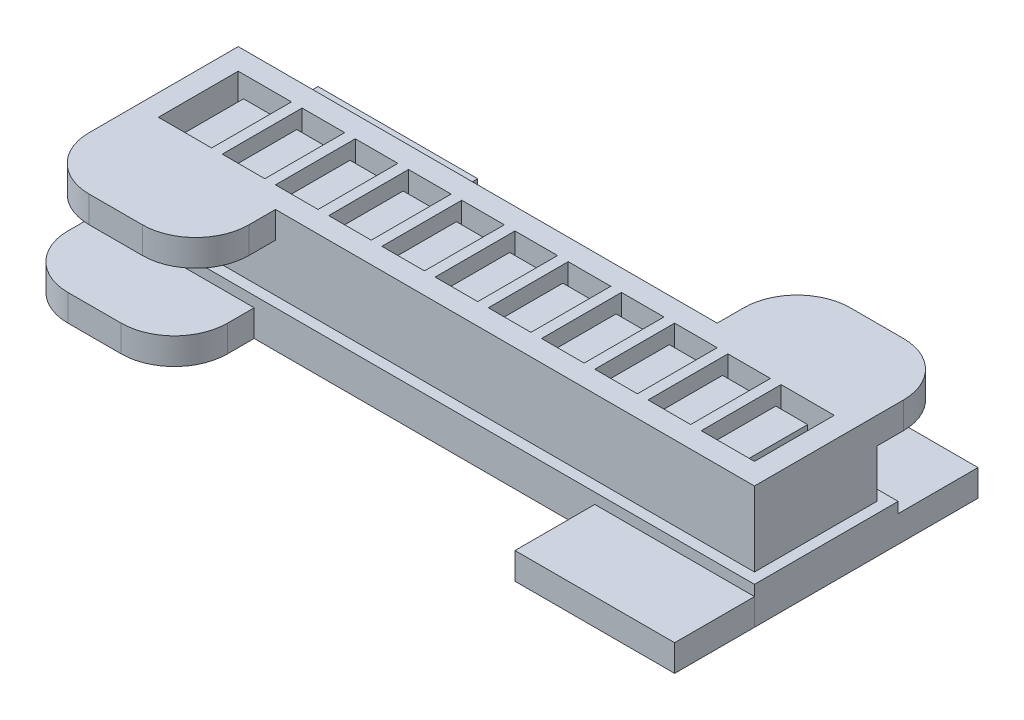
from build123d import *

# Parameters (mm, degrees)
SKETCH1_W                      = 8
SKETCH1_H                      = 15
FIRST_CHAMBER_BLOCK_DEPTH      = 15
SKETCH2_W                      = 6
SKETCH2_H                      = 11
FIRST_CHAMBER_CAVITY_DEPTH     = 13
SKETCH3_W                      = 15
SKETCH3_H                      = 3
CHAMBER_SPACER_DEPTH           = 2
PATTERN_CHAMBERS_COUNT         = 11
PATTERN_CHAMBERS_PITCH         = 10
SKETCH4_W                      = 15
SKETCH4_H                      = 12
THICKEN_END_1_DEPTH            = 2
SKETCH5_W                      = 15
SKETCH5_H                      = 15
THICKEN_END_2_DEPTH            = 2
SKETCH6_W                      = 94
SKETCH6_H                      = 2
CENTRAL_AIR_CHANNEL_DEPTH      = 2
SKETCH7_W                      = 108
SKETCH7_H                      = 13
SKETCH7_W_2                    = 106
SKETCH7_H_2                    = 11
BONDING_RIDGE_DEPTH            = 2
SKETCH9_W                      = 2
SKETCH9_H                      = 2.5
BONDING_BUMPS_DEPTH            = 2
PATTERN_BONDING_BUMPS_COUNT    = 10
PATTERN_BONDING_BUMPS_PITCH    = 10
SKETCH10_W                     = 120
SKETCH10_H                     = 23
ENCASING_BLOCK_DEPTH           = 21
SPLIT_START                    = -6
SPLIT_MOLD_OUTLINE_W           = 120
SPLIT_MOLD_OUTLINE_H           = 23
SPLIT_MOLD_OUTLINE_W_2         = 108
SPLIT_MOLD_OUTLINE_H_2         = 13
SPLIT_MOLD_OUTLINE_W_3         = 106
SPLIT_MOLD_OUTLINE_H_3         = 11
SPLIT_MOLD_OUTLINE_W_4         = 2
SPLIT_MOLD_OUTLINE_H_4         = 2.5
SPLIT_MOLD_DEPTH               = 6
SPLIT_MOLD_2_OUTLINE_W         = 108
SPLIT_MOLD_2_OUTLINE_H         = 13
SPLIT_MOLD_2_OUTLINE_W_2       = 106
SPLIT_MOLD_2_OUTLINE_H_2       = 11
SPLIT_MOLD_2_OUTLINE_W_3       = 2
SPLIT_MOLD_2_OUTLINE_H_3       = 2.5
SPLIT_MOLD_2_DEPTH             = 4
SPLIT_MOLD_3_OUTLINE_W         = 6
SPLIT_MOLD_3_OUTLINE_H         = 11
SPLIT_MOLD_3_DEPTH             = 13
SPLIT_MOLD_4_OUTLINE_W         = 4
SPLIT_MOLD_4_OUTLINE_H         = 2
SPLIT_MOLD_4_DEPTH             = 2
SPLIT_MOLD_5_OUTLINE_W         = 120
SPLIT_MOLD_5_OUTLINE_H         = 23
SPLIT_MOLD_5_DEPTH             = 6
SPLIT_MOLD_6_OUTLINE_W         = 6
SPLIT_MOLD_6_OUTLINE_H         = 11
SPLIT_MOLD_6_DEPTH             = 13
SPLIT_MOLD_7_OUTLINE_W         = 4
SPLIT_MOLD_7_OUTLINE_H         = 2
SPLIT_MOLD_7_DEPTH             = 2
SKETCH11_W                     = 30
SKETCH11_H                     = 5
GRIP_TAB_1_DEPTH               = 15
SKETCH12_W                     = 30
SKETCH12_H                     = 5
GRIP_TAB_2_DEPTH               = 15
FILLET_GRIP_TABS_R             = 10
SKETCH13_W                     = 124
SKETCH13_H                     = 27
SKETCH13_W_2                   = 120
SKETCH13_H_2                   = 23
BASE_MOLD_LIP_DEPTH            = 7
SKETCH14_W                     = 30
SKETCH14_H                     = 5
BASE_GRIP_TABS_1_AND_2_DEPTH   = 15
BASE_GRIP_TABS_1_AND_2_2_DEPTH = 15
SKETCH16_W                     = 30
SKETCH16_H                     = 5
BASE_GRIP_TABS_3_AND_4_DEPTH   = 15
FILLET_BASE_GRIP_TABS_R        = 10


# Read off the part's stored shape, not the designer's step: split mold
with BuildPart() as part:
    # Sketch1 → first chamber block (new body)
    with BuildSketch(Plane.XY):
        with Locations((4, 7.5)):
            Rectangle(SKETCH1_W, SKETCH1_H)
    extrude(amount=FIRST_CHAMBER_BLOCK_DEPTH)

    # Sketch2 → first chamber cavity (cut)
    with BuildSketch(Plane.XZ):
        with Locations((4, 7.5)):
            Rectangle(SKETCH2_W, SKETCH2_H)
    extrude(amount=-FIRST_CHAMBER_CAVITY_DEPTH, mode=Mode.SUBTRACT)

    # Sketch3 → chamber spacer (add)
    with BuildSketch(Plane(origin=(8, 0, 0), x_dir=(0, 0, -1), z_dir=(1, 0, 0))):
        with Locations((-7.5, 1.5)):
            Rectangle(SKETCH3_W, SKETCH3_H)
    extrude(amount=CHAMBER_SPACER_DEPTH)


with BuildPart() as pattern_chambers_1:
    # pattern chambers: pattern copy
    add(part.part.moved(Location(Vector(1, 0, 0) * (1 * PATTERN_CHAMBERS_PITCH))))


with BuildPart() as pattern_chambers_2:
    # pattern chambers: pattern copy
    add(part.part.moved(Location(Vector(1, 0, 0) * (2 * PATTERN_CHAMBERS_PITCH))))


with BuildPart() as pattern_chambers_3:
    # pattern chambers: pattern copy
    add(part.part.moved(Location(Vector(1, 0, 0) * (3 * PATTERN_CHAMBERS_PITCH))))


with BuildPart() as pattern_chambers_4:
    # pattern chambers: pattern copy
    add(part.part.moved(Location(Vector(1, 0, 0) * (4 * PATTERN_CHAMBERS_PITCH))))


with BuildPart() as pattern_chambers_5:
    # pattern chambers: pattern copy
    add(part.part.moved(Location(Vector(1, 0, 0) * (5 * PATTERN_CHAMBERS_PITCH))))


with BuildPart() as pattern_chambers_6:
    # pattern chambers: pattern copy
    add(part.part.moved(Location(Vector(1, 0, 0) * (6 * PATTERN_CHAMBERS_PITCH))))


with BuildPart() as pattern_chambers_7:
    # pattern chambers: pattern copy
    add(part.part.moved(Location(Vector(1, 0, 0) * (7 * PATTERN_CHAMBERS_PITCH))))


with BuildPart() as pattern_chambers_8:
    # pattern chambers: pattern copy
    add(part.part.moved(Location(Vector(1, 0, 0) * (8 * PATTERN_CHAMBERS_PITCH))))


with BuildPart() as pattern_chambers_9:
    # pattern chambers: pattern copy
    add(part.part.moved(Location(Vector(1, 0, 0) * (9 * PATTERN_CHAMBERS_PITCH))))


with BuildPart() as pattern_chambers_10:
    # pattern chambers: pattern copy
    add(part.part.moved(Location(Vector(1, 0, 0) * (10 * PATTERN_CHAMBERS_PITCH))))

    # combine into 1 solid body: union pattern chambers_9, pattern chambers_8, pattern chambers_7, pattern chambers_6, pattern chambers_5, pattern chambers_4, pattern chambers_3, pattern chambers_2, pattern chambers_1, part
    add(pattern_chambers_9.part)
    add(pattern_chambers_8.part)
    add(pattern_chambers_7.part)
    add(pattern_chambers_6.part)
    add(pattern_chambers_5.part)
    add(pattern_chambers_4.part)
    add(pattern_chambers_3.part)
    add(pattern_chambers_2.part)
    add(pattern_chambers_1.part)
    add(part.part)

    # Sketch4 → thicken end 1 (add)
    with BuildSketch(Plane(origin=(108, 0, 0), x_dir=(0, 0, -1), z_dir=(1, 0, 0))):
        with Locations((-7.5, 9)):
            Rectangle(SKETCH4_W, SKETCH4_H)
    extrude(amount=THICKEN_END_1_DEPTH)

    # Sketch5 → thicken end 2 (add)
    with BuildSketch(Plane.ZY):
        with Locations((7.5, 7.5)):
            Rectangle(SKETCH5_W, SKETCH5_H)
    extrude(amount=THICKEN_END_2_DEPTH)

    # Sketch6 → central air channel (cut)
    with BuildSketch(Plane.XZ):
        with Locations((54, 7.5)):
            Rectangle(SKETCH6_W, SKETCH6_H)
    extrude(amount=-CENTRAL_AIR_CHANNEL_DEPTH, mode=Mode.SUBTRACT)

    # Sketch7 → bonding ridge (add)
    with BuildSketch(Plane.XZ):
        with Locations((54, 7.5)):
            Rectangle(SKETCH7_W, SKETCH7_H)
        with Locations((54, 7.5)):
            Rectangle(SKETCH7_W_2, SKETCH7_H_2, mode=Mode.SUBTRACT)
    extrude(amount=BONDING_RIDGE_DEPTH)

    # Sketch9 → bonding bumps (add)
    with BuildSketch(Plane.XZ):
        with Locations((9, 10.75)):
            Rectangle(SKETCH9_W, SKETCH9_H)
        with Locations((9, 4.25)):
            Rectangle(SKETCH9_W, SKETCH9_H)
    bonding_bumps = extrude(amount=BONDING_BUMPS_DEPTH)

    # pattern bonding bumps: bonding bumps ×10
    with Locations(*[(i * PATTERN_BONDING_BUMPS_PITCH, 0, 0) for i in range(1, PATTERN_BONDING_BUMPS_COUNT)]):
        add(bonding_bumps)


with BuildPart() as body_2:
    # Sketch10 → encasing block (new body)
    with BuildSketch(Plane(origin=(0, 15, 0), x_dir=(1, 0, 0), z_dir=(0, 1, 0))):
        with Locations((54, -7.5)):
            Rectangle(SKETCH10_W, SKETCH10_H)
    extrude(amount=-ENCASING_BLOCK_DEPTH)

    # subtract actuator: cut pattern chambers_10
    add(pattern_chambers_10.part, mode=Mode.SUBTRACT)

    # split mold 5 outline → split mold 5 (cut)
    with BuildSketch(Plane(origin=(0, 0, 0), x_dir=(1, 0, 0), z_dir=(0, 1, 0)).offset(SPLIT_START)):
        with Locations((54, -7.5)):
            Rectangle(SPLIT_MOLD_5_OUTLINE_W, SPLIT_MOLD_5_OUTLINE_H)
    extrude(amount=SPLIT_MOLD_5_DEPTH, mode=Mode.SUBTRACT)

    # split mold 6 outline → split mold 6 (cut)
    with BuildSketch(Plane(origin=(0, 0, 0), x_dir=(1, 0, 0), z_dir=(0, 1, 0))):
        with Locations((14, -7.5)):
            Rectangle(SPLIT_MOLD_6_OUTLINE_W, SPLIT_MOLD_6_OUTLINE_H)
        with Locations((4, -7.5)):
            Rectangle(SPLIT_MOLD_6_OUTLINE_W, SPLIT_MOLD_6_OUTLINE_H)
        with Locations((24, -7.5)):
            Rectangle(SPLIT_MOLD_6_OUTLINE_W, SPLIT_MOLD_6_OUTLINE_H)
        with Locations((34, -7.5)):
            Rectangle(SPLIT_MOLD_6_OUTLINE_W, SPLIT_MOLD_6_OUTLINE_H)
        with Locations((44, -7.5)):
            Rectangle(SPLIT_MOLD_6_OUTLINE_W, SPLIT_MOLD_6_OUTLINE_H)
        with Locations((54, -7.5)):
            Rectangle(SPLIT_MOLD_6_OUTLINE_W, SPLIT_MOLD_6_OUTLINE_H)
        with Locations((64, -7.5)):
            Rectangle(SPLIT_MOLD_6_OUTLINE_W, SPLIT_MOLD_6_OUTLINE_H)
        with Locations((74, -7.5)):
            Rectangle(SPLIT_MOLD_6_OUTLINE_W, SPLIT_MOLD_6_OUTLINE_H)
        with Locations((84, -7.5)):
            Rectangle(SPLIT_MOLD_6_OUTLINE_W, SPLIT_MOLD_6_OUTLINE_H)
        with Locations((94, -7.5)):
            Rectangle(SPLIT_MOLD_6_OUTLINE_W, SPLIT_MOLD_6_OUTLINE_H)
        with Locations((104, -7.5)):
            Rectangle(SPLIT_MOLD_6_OUTLINE_W, SPLIT_MOLD_6_OUTLINE_H)
    extrude(amount=SPLIT_MOLD_6_DEPTH, mode=Mode.SUBTRACT)

    # split mold 7 outline → split mold 7 (cut)
    with BuildSketch(Plane(origin=(0, 0, 0), x_dir=(1, 0, 0), z_dir=(0, 1, 0))):
        with Locations((9, -7.5)):
            Rectangle(SPLIT_MOLD_7_OUTLINE_W, SPLIT_MOLD_7_OUTLINE_H)
        with Locations((19, -7.5)):
            Rectangle(SPLIT_MOLD_7_OUTLINE_W, SPLIT_MOLD_7_OUTLINE_H)
        with Locations((29, -7.5)):
            Rectangle(SPLIT_MOLD_7_OUTLINE_W, SPLIT_MOLD_7_OUTLINE_H)
        with Locations((39, -7.5)):
            Rectangle(SPLIT_MOLD_7_OUTLINE_W, SPLIT_MOLD_7_OUTLINE_H)
        with Locations((49, -7.5)):
            Rectangle(SPLIT_MOLD_7_OUTLINE_W, SPLIT_MOLD_7_OUTLINE_H)
        with Locations((59, -7.5)):
            Rectangle(SPLIT_MOLD_7_OUTLINE_W, SPLIT_MOLD_7_OUTLINE_H)
        with Locations((69, -7.5)):
            Rectangle(SPLIT_MOLD_7_OUTLINE_W, SPLIT_MOLD_7_OUTLINE_H)
        with Locations((79, -7.5)):
            Rectangle(SPLIT_MOLD_7_OUTLINE_W, SPLIT_MOLD_7_OUTLINE_H)
        with Locations((89, -7.5)):
            Rectangle(SPLIT_MOLD_7_OUTLINE_W, SPLIT_MOLD_7_OUTLINE_H)
        with Locations((99, -7.5)):
            Rectangle(SPLIT_MOLD_7_OUTLINE_W, SPLIT_MOLD_7_OUTLINE_H)
    extrude(amount=SPLIT_MOLD_7_DEPTH, mode=Mode.SUBTRACT)

    # Sketch11 → grip tab 1 (add)
    with BuildSketch(Plane.XY.offset(19)):
        with Locations((9, 12.5)):
            Rectangle(SKETCH11_W, SKETCH11_H)
    extrude(amount=GRIP_TAB_1_DEPTH)

    # Sketch12 → grip tab 2 (add)
    with BuildSketch(Plane(origin=(0, 0, -4), x_dir=(-1, 0, 0), z_dir=(0, 0, -1))):
        with Locations((-99, 12.5)):
            Rectangle(SKETCH12_W, SKETCH12_H)
    extrude(amount=GRIP_TAB_2_DEPTH)

    # fillet grip tabs
    fillet_grip_tabs_edges = [body_2.edges().sort_by_distance(p)[0] for p in [
        (114, 12.5, -19),
        (84, 12.5, -19),
        (24, 12.5, 34),
        (-6, 12.5, 34),
    ]]
    fillet(fillet_grip_tabs_edges, radius=FILLET_GRIP_TABS_R)


with BuildPart() as body_2_2:
    # split mold outline → split mold (new body)
    # profile 1 of 2: a face of its own
    with BuildSketch(Plane(origin=(0, 0, 0), x_dir=(1, 0, 0), z_dir=(0, 1, 0)).offset(SPLIT_START)):
        with Locations((54, -7.5)):
            Rectangle(SPLIT_MOLD_OUTLINE_W, SPLIT_MOLD_OUTLINE_H)
        with Locations((54, -7.5)):
            Rectangle(SPLIT_MOLD_OUTLINE_W_2, SPLIT_MOLD_OUTLINE_H_2, mode=Mode.SUBTRACT)
    # profile 2 of 2: a face of its own
    with BuildSketch(Plane(origin=(0, 0, 0), x_dir=(1, 0, 0), z_dir=(0, 1, 0)).offset(SPLIT_START)):
        with Locations((54, -7.5)):
            Rectangle(SPLIT_MOLD_OUTLINE_W_3, SPLIT_MOLD_OUTLINE_H_3)
        with Locations((9, -10.75)):
            Rectangle(SPLIT_MOLD_OUTLINE_W_4, SPLIT_MOLD_OUTLINE_H_4, mode=Mode.SUBTRACT)
        with Locations((19, -10.75)):
            Rectangle(SPLIT_MOLD_OUTLINE_W_4, SPLIT_MOLD_OUTLINE_H_4, mode=Mode.SUBTRACT)
        with Locations((29, -10.75)):
            Rectangle(SPLIT_MOLD_OUTLINE_W_4, SPLIT_MOLD_OUTLINE_H_4, mode=Mode.SUBTRACT)
        with Locations((39, -10.75)):
            Rectangle(SPLIT_MOLD_OUTLINE_W_4, SPLIT_MOLD_OUTLINE_H_4, mode=Mode.SUBTRACT)
        with Locations((49, -10.75)):
            Rectangle(SPLIT_MOLD_OUTLINE_W_4, SPLIT_MOLD_OUTLINE_H_4, mode=Mode.SUBTRACT)
        with Locations((59, -10.75)):
            Rectangle(SPLIT_MOLD_OUTLINE_W_4, SPLIT_MOLD_OUTLINE_H_4, mode=Mode.SUBTRACT)
        with Locations((69, -10.75)):
            Rectangle(SPLIT_MOLD_OUTLINE_W_4, SPLIT_MOLD_OUTLINE_H_4, mode=Mode.SUBTRACT)
        with Locations((79, -10.75)):
            Rectangle(SPLIT_MOLD_OUTLINE_W_4, SPLIT_MOLD_OUTLINE_H_4, mode=Mode.SUBTRACT)
        with Locations((89, -10.75)):
            Rectangle(SPLIT_MOLD_OUTLINE_W_4, SPLIT_MOLD_OUTLINE_H_4, mode=Mode.SUBTRACT)
        with Locations((99, -10.75)):
            Rectangle(SPLIT_MOLD_OUTLINE_W_4, SPLIT_MOLD_OUTLINE_H_4, mode=Mode.SUBTRACT)
        with Locations((9, -4.25)):
            Rectangle(SPLIT_MOLD_OUTLINE_W_4, SPLIT_MOLD_OUTLINE_H_4, mode=Mode.SUBTRACT)
        with Locations((19, -4.25)):
            Rectangle(SPLIT_MOLD_OUTLINE_W_4, SPLIT_MOLD_OUTLINE_H_4, mode=Mode.SUBTRACT)
        with Locations((29, -4.25)):
            Rectangle(SPLIT_MOLD_OUTLINE_W_4, SPLIT_MOLD_OUTLINE_H_4, mode=Mode.SUBTRACT)
        with Locations((39, -4.25)):
            Rectangle(SPLIT_MOLD_OUTLINE_W_4, SPLIT_MOLD_OUTLINE_H_4, mode=Mode.SUBTRACT)
        with Locations((49, -4.25)):
            Rectangle(SPLIT_MOLD_OUTLINE_W_4, SPLIT_MOLD_OUTLINE_H_4, mode=Mode.SUBTRACT)
        with Locations((59, -4.25)):
            Rectangle(SPLIT_MOLD_OUTLINE_W_4, SPLIT_MOLD_OUTLINE_H_4, mode=Mode.SUBTRACT)
        with Locations((69, -4.25)):
            Rectangle(SPLIT_MOLD_OUTLINE_W_4, SPLIT_MOLD_OUTLINE_H_4, mode=Mode.SUBTRACT)
        with Locations((79, -4.25)):
            Rectangle(SPLIT_MOLD_OUTLINE_W_4, SPLIT_MOLD_OUTLINE_H_4, mode=Mode.SUBTRACT)
        with Locations((89, -4.25)):
            Rectangle(SPLIT_MOLD_OUTLINE_W_4, SPLIT_MOLD_OUTLINE_H_4, mode=Mode.SUBTRACT)
        with Locations((99, -4.25)):
            Rectangle(SPLIT_MOLD_OUTLINE_W_4, SPLIT_MOLD_OUTLINE_H_4, mode=Mode.SUBTRACT)
    extrude(amount=SPLIT_MOLD_DEPTH)

    # split mold 2 outline → split mold 2 (add)
    # profile 1 of 21: a face of its own
    with BuildSketch(Plane(origin=(0, 0, 0), x_dir=(1, 0, 0), z_dir=(0, 1, 0)).offset(SPLIT_START)):
        with Locations((54, -7.5)):
            Rectangle(SPLIT_MOLD_2_OUTLINE_W, SPLIT_MOLD_2_OUTLINE_H)
        with Locations((54, -7.5)):
            Rectangle(SPLIT_MOLD_2_OUTLINE_W_2, SPLIT_MOLD_2_OUTLINE_H_2, mode=Mode.SUBTRACT)
    # profile 2 of 21: a face of its own
    with BuildSketch(Plane(origin=(0, 0, 0), x_dir=(1, 0, 0), z_dir=(0, 1, 0)).offset(SPLIT_START)):
        with Locations((9, -10.75)):
            Rectangle(SPLIT_MOLD_2_OUTLINE_W_3, SPLIT_MOLD_2_OUTLINE_H_3)
    # profile 3 of 21: a face of its own
    with BuildSketch(Plane(origin=(0, 0, 0), x_dir=(1, 0, 0), z_dir=(0, 1, 0)).offset(SPLIT_START)):
        with Locations((19, -10.75)):
            Rectangle(SPLIT_MOLD_2_OUTLINE_W_3, SPLIT_MOLD_2_OUTLINE_H_3)
    # profile 4 of 21: a face of its own
    with BuildSketch(Plane(origin=(0, 0, 0), x_dir=(1, 0, 0), z_dir=(0, 1, 0)).offset(SPLIT_START)):
        with Locations((29, -10.75)):
            Rectangle(SPLIT_MOLD_2_OUTLINE_W_3, SPLIT_MOLD_2_OUTLINE_H_3)
    # profile 5 of 21: a face of its own
    with BuildSketch(Plane(origin=(0, 0, 0), x_dir=(1, 0, 0), z_dir=(0, 1, 0)).offset(SPLIT_START)):
        with Locations((39, -10.75)):
            Rectangle(SPLIT_MOLD_2_OUTLINE_W_3, SPLIT_MOLD_2_OUTLINE_H_3)
    # profile 6 of 21: a face of its own
    with BuildSketch(Plane(origin=(0, 0, 0), x_dir=(1, 0, 0), z_dir=(0, 1, 0)).offset(SPLIT_START)):
        with Locations((49, -10.75)):
            Rectangle(SPLIT_MOLD_2_OUTLINE_W_3, SPLIT_MOLD_2_OUTLINE_H_3)
    # profile 7 of 21: a face of its own
    with BuildSketch(Plane(origin=(0, 0, 0), x_dir=(1, 0, 0), z_dir=(0, 1, 0)).offset(SPLIT_START)):
        with Locations((59, -10.75)):
            Rectangle(SPLIT_MOLD_2_OUTLINE_W_3, SPLIT_MOLD_2_OUTLINE_H_3)
    # profile 8 of 21: a face of its own
    with BuildSketch(Plane(origin=(0, 0, 0), x_dir=(1, 0, 0), z_dir=(0, 1, 0)).offset(SPLIT_START)):
        with Locations((69, -10.75)):
            Rectangle(SPLIT_MOLD_2_OUTLINE_W_3, SPLIT_MOLD_2_OUTLINE_H_3)
    # profile 9 of 21: a face of its own
    with BuildSketch(Plane(origin=(0, 0, 0), x_dir=(1, 0, 0), z_dir=(0, 1, 0)).offset(SPLIT_START)):
        with Locations((79, -10.75)):
            Rectangle(SPLIT_MOLD_2_OUTLINE_W_3, SPLIT_MOLD_2_OUTLINE_H_3)
    # profile 10 of 21: a face of its own
    with BuildSketch(Plane(origin=(0, 0, 0), x_dir=(1, 0, 0), z_dir=(0, 1, 0)).offset(SPLIT_START)):
        with Locations((89, -10.75)):
            Rectangle(SPLIT_MOLD_2_OUTLINE_W_3, SPLIT_MOLD_2_OUTLINE_H_3)
    # profile 11 of 21: a face of its own
    with BuildSketch(Plane(origin=(0, 0, 0), x_dir=(1, 0, 0), z_dir=(0, 1, 0)).offset(SPLIT_START)):
        with Locations((99, -10.75)):
            Rectangle(SPLIT_MOLD_2_OUTLINE_W_3, SPLIT_MOLD_2_OUTLINE_H_3)
    # profile 12 of 21: a face of its own
    with BuildSketch(Plane(origin=(0, 0, 0), x_dir=(1, 0, 0), z_dir=(0, 1, 0)).offset(SPLIT_START)):
        with Locations((99, -4.25)):
            Rectangle(SPLIT_MOLD_2_OUTLINE_W_3, SPLIT_MOLD_2_OUTLINE_H_3)
    # profile 13 of 21: a face of its own
    with BuildSketch(Plane(origin=(0, 0, 0), x_dir=(1, 0, 0), z_dir=(0, 1, 0)).offset(SPLIT_START)):
        with Locations((89, -4.25)):
            Rectangle(SPLIT_MOLD_2_OUTLINE_W_3, SPLIT_MOLD_2_OUTLINE_H_3)
    # profile 14 of 21: a face of its own
    with BuildSketch(Plane(origin=(0, 0, 0), x_dir=(1, 0, 0), z_dir=(0, 1, 0)).offset(SPLIT_START)):
        with Locations((79, -4.25)):
            Rectangle(SPLIT_MOLD_2_OUTLINE_W_3, SPLIT_MOLD_2_OUTLINE_H_3)
    # profile 15 of 21: a face of its own
    with BuildSketch(Plane(origin=(0, 0, 0), x_dir=(1, 0, 0), z_dir=(0, 1, 0)).offset(SPLIT_START)):
        with Locations((69, -4.25)):
            Rectangle(SPLIT_MOLD_2_OUTLINE_W_3, SPLIT_MOLD_2_OUTLINE_H_3)
    # profile 16 of 21: a face of its own
    with BuildSketch(Plane(origin=(0, 0, 0), x_dir=(1, 0, 0), z_dir=(0, 1, 0)).offset(SPLIT_START)):
        with Locations((59, -4.25)):
            Rectangle(SPLIT_MOLD_2_OUTLINE_W_3, SPLIT_MOLD_2_OUTLINE_H_3)
    # profile 17 of 21: a face of its own
    with BuildSketch(Plane(origin=(0, 0, 0), x_dir=(1, 0, 0), z_dir=(0, 1, 0)).offset(SPLIT_START)):
        with Locations((49, -4.25)):
            Rectangle(SPLIT_MOLD_2_OUTLINE_W_3, SPLIT_MOLD_2_OUTLINE_H_3)
    # profile 18 of 21: a face of its own
    with BuildSketch(Plane(origin=(0, 0, 0), x_dir=(1, 0, 0), z_dir=(0, 1, 0)).offset(SPLIT_START)):
        with Locations((39, -4.25)):
            Rectangle(SPLIT_MOLD_2_OUTLINE_W_3, SPLIT_MOLD_2_OUTLINE_H_3)
    # profile 19 of 21: a face of its own
    with BuildSketch(Plane(origin=(0, 0, 0), x_dir=(1, 0, 0), z_dir=(0, 1, 0)).offset(SPLIT_START)):
        with Locations((29, -4.25)):
            Rectangle(SPLIT_MOLD_2_OUTLINE_W_3, SPLIT_MOLD_2_OUTLINE_H_3)
    # profile 20 of 21: a face of its own
    with BuildSketch(Plane(origin=(0, 0, 0), x_dir=(1, 0, 0), z_dir=(0, 1, 0)).offset(SPLIT_START)):
        with Locations((19, -4.25)):
            Rectangle(SPLIT_MOLD_2_OUTLINE_W_3, SPLIT_MOLD_2_OUTLINE_H_3)
    # profile 21 of 21: a face of its own
    with BuildSketch(Plane(origin=(0, 0, 0), x_dir=(1, 0, 0), z_dir=(0, 1, 0)).offset(SPLIT_START)):
        with Locations((9, -4.25)):
            Rectangle(SPLIT_MOLD_2_OUTLINE_W_3, SPLIT_MOLD_2_OUTLINE_H_3)
    extrude(amount=SPLIT_MOLD_2_DEPTH)


with BuildPart() as body_3:
    # split mold 3 outline → split mold 3 (new body)
    with BuildSketch(Plane(origin=(0, 0, 0), x_dir=(1, 0, 0), z_dir=(0, 1, 0))):
        with Locations((4, -7.5)):
            Rectangle(SPLIT_MOLD_3_OUTLINE_W, SPLIT_MOLD_3_OUTLINE_H)
        with Locations((14, -7.5)):
            Rectangle(SPLIT_MOLD_3_OUTLINE_W, SPLIT_MOLD_3_OUTLINE_H)
        with Locations((24, -7.5)):
            Rectangle(SPLIT_MOLD_3_OUTLINE_W, SPLIT_MOLD_3_OUTLINE_H)
        with Locations((34, -7.5)):
            Rectangle(SPLIT_MOLD_3_OUTLINE_W, SPLIT_MOLD_3_OUTLINE_H)
        with Locations((44, -7.5)):
            Rectangle(SPLIT_MOLD_3_OUTLINE_W, SPLIT_MOLD_3_OUTLINE_H)
        with Locations((54, -7.5)):
            Rectangle(SPLIT_MOLD_3_OUTLINE_W, SPLIT_MOLD_3_OUTLINE_H)
        with Locations((64, -7.5)):
            Rectangle(SPLIT_MOLD_3_OUTLINE_W, SPLIT_MOLD_3_OUTLINE_H)
        with Locations((74, -7.5)):
            Rectangle(SPLIT_MOLD_3_OUTLINE_W, SPLIT_MOLD_3_OUTLINE_H)
        with Locations((84, -7.5)):
            Rectangle(SPLIT_MOLD_3_OUTLINE_W, SPLIT_MOLD_3_OUTLINE_H)
        with Locations((94, -7.5)):
            Rectangle(SPLIT_MOLD_3_OUTLINE_W, SPLIT_MOLD_3_OUTLINE_H)
        with Locations((104, -7.5)):
            Rectangle(SPLIT_MOLD_3_OUTLINE_W, SPLIT_MOLD_3_OUTLINE_H)
    extrude(amount=SPLIT_MOLD_3_DEPTH)

    # split mold 4 outline → split mold 4 (add)
    with BuildSketch(Plane(origin=(0, 0, 0), x_dir=(1, 0, 0), z_dir=(0, 1, 0))):
        with Locations((9, -7.5)):
            Rectangle(SPLIT_MOLD_4_OUTLINE_W, SPLIT_MOLD_4_OUTLINE_H)
        with Locations((19, -7.5)):
            Rectangle(SPLIT_MOLD_4_OUTLINE_W, SPLIT_MOLD_4_OUTLINE_H)
        with Locations((29, -7.5)):
            Rectangle(SPLIT_MOLD_4_OUTLINE_W, SPLIT_MOLD_4_OUTLINE_H)
        with Locations((39, -7.5)):
            Rectangle(SPLIT_MOLD_4_OUTLINE_W, SPLIT_MOLD_4_OUTLINE_H)
        with Locations((49, -7.5)):
            Rectangle(SPLIT_MOLD_4_OUTLINE_W, SPLIT_MOLD_4_OUTLINE_H)
        with Locations((59, -7.5)):
            Rectangle(SPLIT_MOLD_4_OUTLINE_W, SPLIT_MOLD_4_OUTLINE_H)
        with Locations((69, -7.5)):
            Rectangle(SPLIT_MOLD_4_OUTLINE_W, SPLIT_MOLD_4_OUTLINE_H)
        with Locations((79, -7.5)):
            Rectangle(SPLIT_MOLD_4_OUTLINE_W, SPLIT_MOLD_4_OUTLINE_H)
        with Locations((89, -7.5)):
            Rectangle(SPLIT_MOLD_4_OUTLINE_W, SPLIT_MOLD_4_OUTLINE_H)
        with Locations((99, -7.5)):
            Rectangle(SPLIT_MOLD_4_OUTLINE_W, SPLIT_MOLD_4_OUTLINE_H)
    extrude(amount=SPLIT_MOLD_4_DEPTH)


with BuildPart() as body_4:
    # Sketch13 → base mold lip (new body)
    with BuildSketch(Plane.XZ.offset(6)):
        with Locations((54, 7.5)):
            Rectangle(SKETCH13_W, SKETCH13_H)
        with Locations((54, 7.5)):
            Rectangle(SKETCH13_W_2, SKETCH13_H_2, mode=Mode.SUBTRACT)
    extrude(amount=-BASE_MOLD_LIP_DEPTH)

    # Sketch16 → base grip tabs 3 and 4 (add)
    with BuildSketch(Plane(origin=(0, 0, -6), x_dir=(-1, 0, 0), z_dir=(0, 0, -1))):
        with Locations((-101, -3.5)):
            Rectangle(SKETCH16_W, SKETCH16_H)
        with Locations((-7, -3.5)):
            Rectangle(SKETCH16_W, SKETCH16_H)
    extrude(amount=BASE_GRIP_TABS_3_AND_4_DEPTH)


with BuildPart() as body_5:
    # Sketch14 → base grip tabs 1 and 2 (new body)
    with BuildSketch(Plane.XY.offset(21)):
        with Locations((7, -3.5)):
            Rectangle(SKETCH14_W, SKETCH14_H)
    extrude(amount=BASE_GRIP_TABS_1_AND_2_DEPTH)

    # fillet base grip tabs
    fillet_base_grip_tabs_edges = [body_5.edges().sort_by_distance(p)[0] for p in [
        (22, -3.5, 36),
        (-8, -3.5, 36),
    ]]
    fillet(fillet_base_grip_tabs_edges, radius=FILLET_BASE_GRIP_TABS_R)


with BuildPart() as body_6:
    # Sketch14 → base grip tabs 1 and 2 2 (new body)
    with BuildSketch(Plane.XY.offset(21)):
        with Locations((101, -3.5)):
            Rectangle(SKETCH14_W, SKETCH14_H)
    extrude(amount=BASE_GRIP_TABS_1_AND_2_2_DEPTH)


solid = Compound([body_2.part, body_2_2.part, body_3.part, body_4.part, body_5.part, body_6.part])
